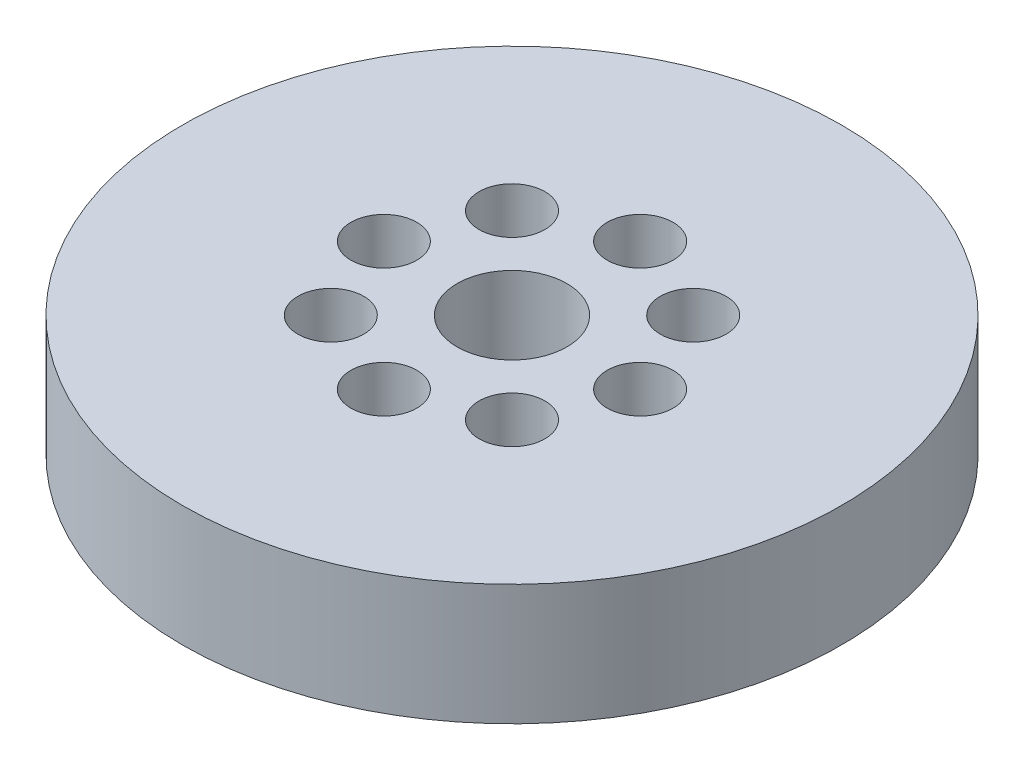
from build123d import *

# Parameters (mm, degrees)
SKETCH1_R           = 30
BOSS_EXTRUDE1_DEPTH = 11
SKETCH2_R           = 5
CUT_EXTRUDE1_DEPTH  = 44.829214002
SKETCH3_R           = 2.996397125
CUT_EXTRUDE2_DEPTH  = 8.254053305
CIRPATTERN1_COUNT   = 8


with BuildPart() as part:
    # Sketch1 → Boss-Extrude1 (new body)
    with BuildSketch(Plane(origin=(0, 0, 0), x_dir=(1, 0, 0), z_dir=(0, 1, 0))):
        Circle(SKETCH1_R)
    extrude(amount=BOSS_EXTRUDE1_DEPTH)

    # Sketch2 → Cut-Extrude1 (cut, through all)
    with BuildSketch(Plane(origin=(0, 0, 0), x_dir=(1, 0, 0), z_dir=(0, 1, 0))):
        Circle(SKETCH2_R)
    extrude(amount=CUT_EXTRUDE1_DEPTH, mode=Mode.SUBTRACT)

    # Sketch3 → Cut-Extrude2 (cut)
    with BuildSketch(Plane(origin=(0, 11, 0), x_dir=(1, 0, 0), z_dir=(0, 1, 0))):
        with Locations((-11.664578658, 0)):
            Circle(SKETCH3_R)
    cut_extrude2 = extrude(amount=-CUT_EXTRUDE2_DEPTH, mode=Mode.SUBTRACT)

    # CirPattern1: Cut-Extrude2 ×8 about axis
    cirpattern1_axis = Axis((0, 0, 0), (0, 1, 0))
    for i in range(1, CIRPATTERN1_COUNT):
        add(cut_extrude2.rotate(cirpattern1_axis, i * 360 / CIRPATTERN1_COUNT), mode=Mode.SUBTRACT)


solid = part.part
